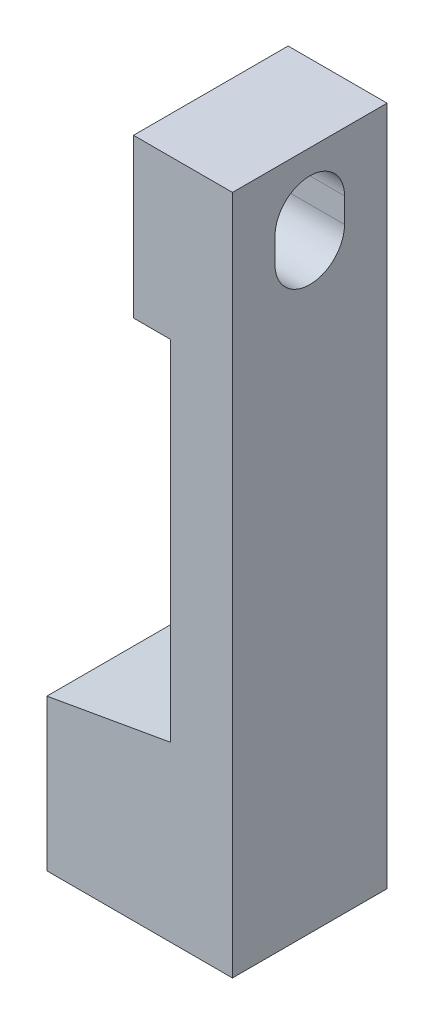
from build123d import *

# Parameters (mm, degrees)
SKETCH1_W           = 15.875
SKETCH1_H           = 69.85
BOSS_EXTRUDE1_DEPTH = 6.35
BOSS_EXTRUDE2_DEPTH = 3.81
BOSS_EXTRUDE3_DEPTH = 12.7
CUT_EXTRUDE1_DEPTH  = 41.411152545
CUT_EXTRUDE2_DEPTH  = 41.566760177


with BuildPart() as part:
    # Sketch1 → Boss-Extrude1 (new body)
    with BuildSketch(Plane(origin=(0, 0, 0), x_dir=(0, 0, -1), z_dir=(1, 0, 0))):
        Rectangle(SKETCH1_W, SKETCH1_H)
    extrude(amount=BOSS_EXTRUDE1_DEPTH)

    # Sketch2 → Boss-Extrude2 (add)
    with BuildSketch(Plane.ZY):
        Polygon((7.9375, 34.925), (-7.9375, 34.925), (-7.9375, 15.875), (7.9375, 18.674190819), align=None)
    extrude(amount=BOSS_EXTRUDE2_DEPTH)

    # Sketch3 → Boss-Extrude3 (add)
    with BuildSketch(Plane.ZY):
        Polygon((-7.9375, -19.944190819), (-7.9375, -34.925), (7.9375, -34.925), (7.9375, -17.145), align=None)
    extrude(amount=BOSS_EXTRUDE3_DEPTH)

    # Sketch6 → Cut-Extrude1 (cut, through all)
    with BuildSketch(Plane(origin=(0, 0, -7.9375), x_dir=(-1, 0, 0), z_dir=(0, 0, -1))):
        Polygon((0, -17.145), (12.7, -17.145), (12.7, -19.384352655), align=None)
    extrude(amount=-CUT_EXTRUDE1_DEPTH, mode=Mode.SUBTRACT)

    # Sketch7 → Cut-Extrude2 (cut, through all)
    with BuildSketch(Plane(origin=(6.35, 0, 0), x_dir=(0, 0, -1), z_dir=(1, 0, 0))):
        with BuildLine():
            Line((3.5687, 28.861329786), (3.5687, 26.321329786))
            ThreePointArc((3.5687, 26.321329786), (0, 22.752629786), (-3.5687, 26.321329786))
            Line((-3.5687, 26.321329786), (-3.5687, 28.861329786))
            ThreePointArc((-3.5687, 28.861329786), (0, 32.430029786), (3.5687, 28.861329786))
        make_face()
    extrude(amount=-CUT_EXTRUDE2_DEPTH, mode=Mode.SUBTRACT)


solid = part.part
